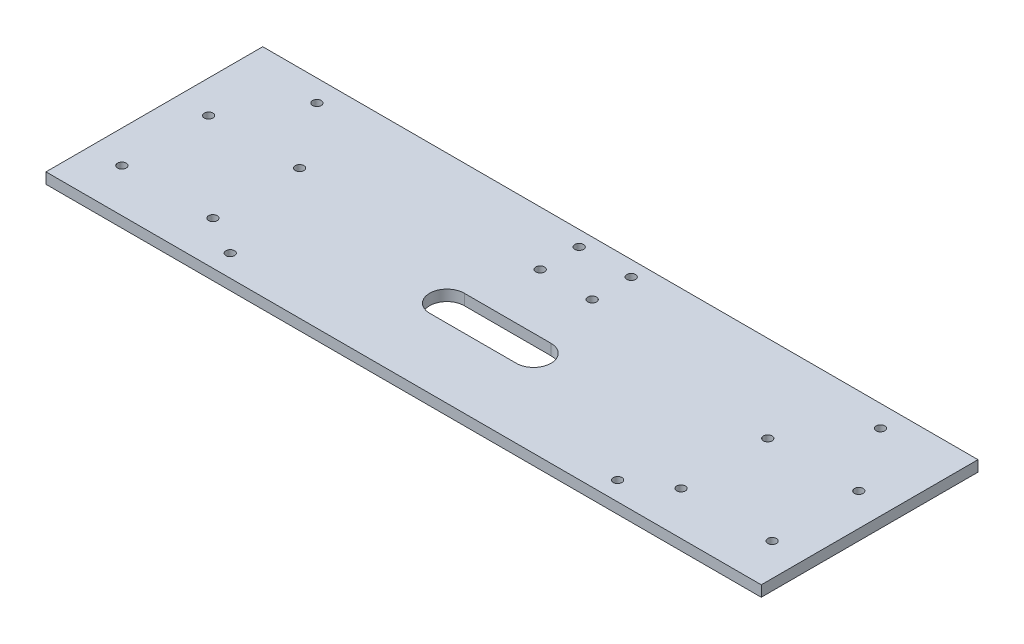
from build123d import *

# Parameters (mm, degrees)
SKETCH_1_W          = 330
SKETCH_1_H          = 100
EXTRUDE_1_DEPTH     = 5
SKETCH_3_R          = 2
CUT_EXTRUDE_1_DEPTH = 259.310540517
SKETCH_4_R          = 2
CUT_EXTRUDE_2_DEPTH = 259.310540517
SKETCH_5_R          = 2
CUT_EXTRUDE_3_DEPTH = 259.310540517


with BuildPart() as part:
    # 草图1 → 凸台-拉伸1 (new body)
    with BuildSketch(Plane(origin=(0, 0, 0), x_dir=(1, 0, 0), z_dir=(0, 1, 0))):
        with Locations((9.630350195, -140.272373541)):
            Rectangle(SKETCH_1_W, SKETCH_1_H)
    extrude(amount=EXTRUDE_1_DEPTH)

    # 草图3 → 切除-拉伸1 (cut, through all)
    with BuildSketch(Plane(origin=(0, 5, 0), x_dir=(1, 0, 0), z_dir=(0, 1, 0))):
        with Locations((-2.369649805, -97.272373541)):
            Circle(SKETCH_3_R)
        with Locations((21.630350195, -97.272373541)):
            Circle(SKETCH_3_R)
        with Locations((-2.369649805, -115.272373541)):
            Circle(SKETCH_3_R)
        with Locations((21.630350195, -115.272373541)):
            Circle(SKETCH_3_R)
    extrude(amount=-CUT_EXTRUDE_1_DEPTH, mode=Mode.SUBTRACT)

    # 草图4 → 切除-拉伸2 (cut, through all)
    with BuildSketch(Plane(origin=(0, 5, 0), x_dir=(1, 0, 0), z_dir=(0, 1, 0))):
        with Locations((-140.369649805, -170.272373541)):
            Circle(SKETCH_4_R)
        with Locations((-140.369649805, -130.272373541)):
            Circle(SKETCH_4_R)
        with Locations((-98.369649805, -170.272373541)):
            Circle(SKETCH_4_R)
        with Locations((-98.369649805, -130.272373541)):
            Circle(SKETCH_4_R)
        with Locations((117.630350195, -130.272373541)):
            Circle(SKETCH_4_R)
        with Locations((117.630350195, -170.272373541)):
            Circle(SKETCH_4_R)
        with Locations((159.630350195, -130.272373541)):
            Circle(SKETCH_4_R)
        with Locations((159.630350195, -170.272373541)):
            Circle(SKETCH_4_R)
        with BuildLine():
            Line((-10.369649805, -142.272373541), (29.630350195, -142.272373541))
            ThreePointArc((29.630350195, -142.272373541), (37.630350195, -150.272373541), (29.630350195, -158.272373541))
            Line((29.630350195, -158.272373541), (-10.369649805, -158.272373541))
            ThreePointArc((-10.369649805, -158.272373541), (-18.369649805, -150.272373541), (-10.369649805, -142.272373541))
        make_face()
    extrude(amount=-CUT_EXTRUDE_2_DEPTH, mode=Mode.SUBTRACT)

    # 草图5 → 切除-拉伸3 (cut, through all)
    with BuildSketch(Plane(origin=(0, 5, 0), x_dir=(1, 0, 0), z_dir=(0, 1, 0))):
        with Locations((-120.369649805, -100.272373541)):
            Circle(SKETCH_5_R)
        with Locations((139.630350195, -100.272373541)):
            Circle(SKETCH_5_R)
        with Locations((-80.369649805, -180.272373541)):
            Circle(SKETCH_5_R)
        with Locations((99.630350195, -181.5555669)):
            Circle(SKETCH_5_R)
    extrude(amount=-CUT_EXTRUDE_3_DEPTH, mode=Mode.SUBTRACT)


solid = part.part
